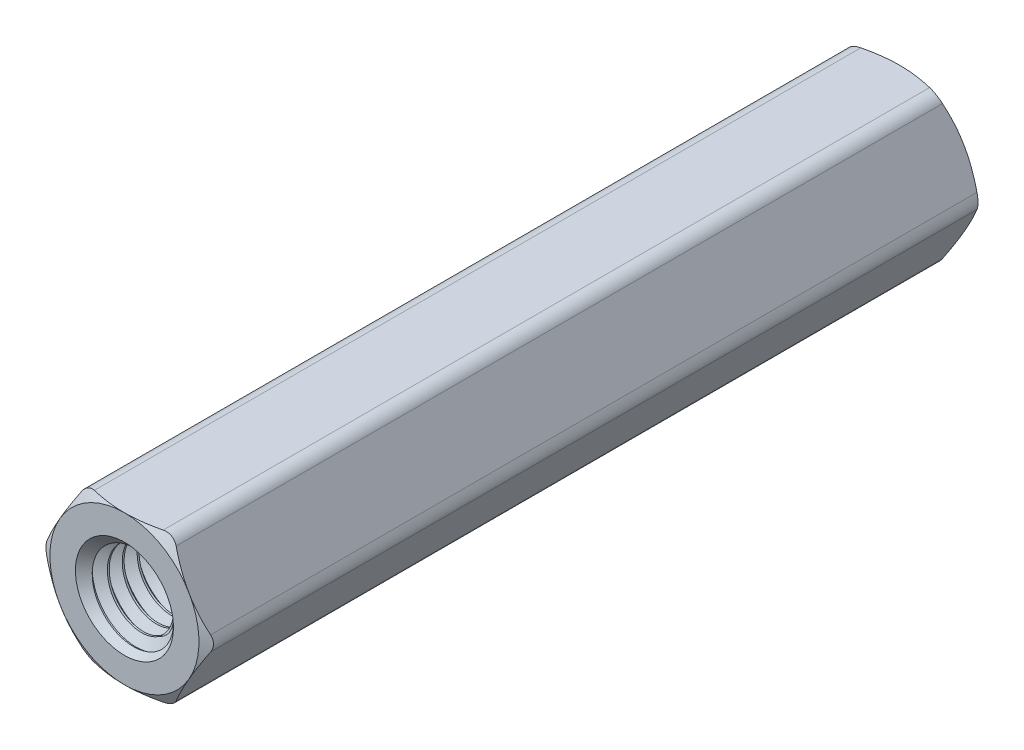
from build123d import *

# Parameters (mm, degrees)
SKETCH4_R           = 3.190875
BOSS_EXTRUDE1_DEPTH = 20.6375
SKETCH5_OUTSIDE_W   = 167.748
SKETCH5_OUTSIDE_H   = 166.52
SKETCH5_OUTSIDE_R   = 3.96875
CUT_EXTRUDE1_DEPTH  = 42.717836757
CUT_EXTRUDE1_DRAFT  = -60
SKETCH6_OUTSIDE_W   = 167.748
SKETCH6_OUTSIDE_H   = 166.52
SKETCH6_OUTSIDE_R   = 3.96875
CUT_EXTRUDE2_DEPTH  = 42.717836757
CUT_EXTRUDE2_DRAFT  = -60
FILLET1_R           = 0.79375
BOSS_EXTRUDE2_START = -12.7
SKETCH7_R           = 2.6114375
BOSS_EXTRUDE2_DEPTH = 12.7
SKETCH8_W           = 12.7
SKETCH8_H           = 2.413
CUT_SWEEP1_PITCH    = 0.79375
CUT_SWEEP1_TO       = 12.7
CIRPATTERN1_COUNT   = 2


with BuildPart() as part:
    # Sketch3 → Revolve1 (revolve)
    with BuildSketch(Plane(origin=(0, 0, 0), x_dir=(0, 0, -1), z_dir=(1, 0, 0))):
        Polygon((-20.4390625, 2.413), (-7.9375, 2.413), (-7.9375, 0), (7.9375, 0), (7.9375, 2.413), (20.6375, 2.413), (20.6375, 3.96875), (0, 3.96875), (-20.6375, 3.96875), (-20.6375, 2.6114375), align=None)
        Polygon((-20.4390625, 2.413), (-7.9375, 2.413), (-7.9375, 0), (7.9375, 0), (7.9375, 2.413), (20.6375, 2.413), (20.6375, 3.96875), (0, 3.96875), (-20.6375, 3.96875), (-20.6375, 2.6114375), align=None)
    revolve(axis=Axis((0, 0, 7.9375), (0, 0, 1)))

    # Sketch4 → Boss-Extrude1 (add, symmetric)
    with BuildSketch(Plane.XY):
        Polygon((-2.291358881, 3.96875), (-4.582717762, 0), (-2.291358881, -3.96875), (2.291358881, -3.96875), (4.582717762, 0), (2.291358881, 3.96875), align=None)
        Circle(SKETCH4_R, mode=Mode.SUBTRACT)
    extrude(amount=BOSS_EXTRUDE1_DEPTH, both=True)


with BuildPart() as cut_extrude1_tool:
    # Sketch5 outside → Cut-Extrude1 (with draft: the straight prism first)
    with BuildSketch(Plane.XY.offset(20.6375)):
        Rectangle(SKETCH5_OUTSIDE_W, SKETCH5_OUTSIDE_H)
        Circle(SKETCH5_OUTSIDE_R, mode=Mode.SUBTRACT)
    extrude(amount=-CUT_EXTRUDE1_DEPTH)
    # Cut-Extrude1: the draft: its side faces are tilted about the plane it starts from
    cut_extrude1_sides = [cut_extrude1_tool.faces().sort_by_distance(p)[0] for p in [
        (0, -83.26, -0.721418378),
        (83.874, 0, -0.721418378),
        (0, 83.26, -0.721418378),
        (-83.874, 0, -0.721418378),
        (-3.96875, 0, -0.721418378),
    ]]
    draft(cut_extrude1_sides, Plane.XY.offset(20.6375), CUT_EXTRUDE1_DRAFT)


with BuildPart() as part_1:
    add(part.part)

    # Cut-Extrude1: cut by cut_extrude1_tool
    add(cut_extrude1_tool.part, mode=Mode.SUBTRACT)


with BuildPart() as cut_extrude2_tool:
    # Sketch6 outside → Cut-Extrude2 (with draft: the straight prism first)
    with BuildSketch(Plane(origin=(0, 0, -20.6375), x_dir=(-1, 0, 0), z_dir=(0, 0, -1))):
        Rectangle(SKETCH6_OUTSIDE_W, SKETCH6_OUTSIDE_H)
        Circle(SKETCH6_OUTSIDE_R, mode=Mode.SUBTRACT)
    extrude(amount=-CUT_EXTRUDE2_DEPTH)
    # Cut-Extrude2: the draft: its side faces are tilted about the plane it starts from
    cut_extrude2_sides = [cut_extrude2_tool.faces().sort_by_distance(p)[0] for p in [
        (0, -83.26, 0.721418378),
        (-83.874, 0, 0.721418378),
        (0, 83.26, 0.721418378),
        (83.874, 0, 0.721418378),
        (3.96875, 0, 0.721418378),
    ]]
    draft(cut_extrude2_sides, Plane(origin=(0, 0, -20.6375), x_dir=(-1, 0, 0), z_dir=(0, 0, -1)), CUT_EXTRUDE2_DRAFT)


with BuildPart() as part_2:
    add(part_1.part)

    # Cut-Extrude2: cut by cut_extrude2_tool
    add(cut_extrude2_tool.part, mode=Mode.SUBTRACT)

    # Fillet1
    fillet1_edges = [part_2.edges().sort_by_distance(p)[0] for p in [
        (2.291358881, 3.96875, 0),
        (-4.582717762, 0, 0),
        (-2.291358881, -3.96875, 0),
        (2.291358881, -3.96875, 0),
        (4.582717762, 0, 0),
        (-2.291358881, 3.96875, 0),
    ]]
    fillet(fillet1_edges, radius=FILLET1_R)

    # Split1
    split(bisect_by=Plane.XY, keep=Keep.TOP)

    # Sketch7 → Boss-Extrude2 (add)
    with BuildSketch(Plane(origin=(0, 0, 7.9375), x_dir=(-1, 0, 0), z_dir=(0, 0, -1)).offset(BOSS_EXTRUDE2_START)):
        Circle(SKETCH7_R)
    extrude(amount=BOSS_EXTRUDE2_DEPTH)


with BuildPart() as body_2:
    # Sketch8 → Revolve2 (revolve)
    with BuildSketch(Plane(origin=(0, 0, 0), x_dir=(0, 0, -1), z_dir=(1, 0, 0))):
        with Locations((-14.2875, 1.2065)):
            Rectangle(SKETCH8_W, SKETCH8_H)
    revolve(axis=Axis((0, 0, 7.9375), (0, 0, 1)))

    # Cut-Sweep1: arcs per turn and ends read off the stored shape
    # Cut-Sweep1: the profile of Sketch10 screwed along a right-hand helix through 18 turns, 8 arcs to a turn; built about Z, then put on its axis
    cut_sweep1_z = Axis((0, 0, 0), (0, 0, 1))
    cut_sweep1_corners = [(1.897444252, 0, -1.190625), (1.897444252, 0, -1.09140625), (2.455962979, 0, -0.768945313), (2.455962979, 0, -1.513085938)]
    with BuildLine(mode=Mode.PRIVATE) as cut_sweep1_profile:
        Line(cut_sweep1_corners[0], cut_sweep1_corners[1])
        Line(cut_sweep1_corners[1], cut_sweep1_corners[2])
        Line(cut_sweep1_corners[2], cut_sweep1_corners[3])
        Line(cut_sweep1_corners[3], cut_sweep1_corners[0])
    cut_sweep1_cap = Face(cut_sweep1_profile.wire())
    cut_sweep1_turn_angles = [0, 22.5, 45, 67.5, 90, 112.5, 135, 157.5, 180, 202.5, 225, 247.5, 270, 292.5, 315, 337.5, 360]
    cut_sweep1_turn_weights = [1, 0.9238795325112867, 1, 0.9238795325112867, 1, 0.9238795325112867, 1, 0.9238795325112867, 1, 0.9238795325112867, 1, 0.9238795325112867, 1, 0.9238795325112867, 1, 0.9238795325112867, 1]
    cut_sweep1_turn_rails = [Edge.make_bspline([Vector(p[0], p[1], 0).rotate(cut_sweep1_z, cut_sweep1_turn_angles[k]) / cut_sweep1_turn_weights[k] + Vector(0, 0, p[2] + CUT_SWEEP1_PITCH * cut_sweep1_turn_angles[k] / 360) for k in range(17)], [0, 0, 0, 1, 1, 2, 2, 3, 3, 4, 4, 5, 5, 6, 6, 7, 7, 8, 8, 8], 2, cut_sweep1_turn_weights) for p in cut_sweep1_corners]
    cut_sweep1_turn_sides = [Face.make_surface_from_curves(cut_sweep1_turn_rails[p[0]], cut_sweep1_turn_rails[p[1]]) for p in [(0, 1), (1, 2), (2, 3), (3, 0)]]
    cut_sweep1 = Plane(origin=(0, 0, 20.6375), x_dir=(0, 1, 0), z_dir=(0, 0, -1)) * split(Solid(Shell([*[p.moved(Location((0, 0, CUT_SWEEP1_PITCH * i))) for i in range(18) for p in cut_sweep1_turn_sides], cut_sweep1_cap, cut_sweep1_cap.rotate(cut_sweep1_z, 6480).moved(Location((0, 0, CUT_SWEEP1_PITCH * 6480 / 360)))])), bisect_by=Plane.XY.offset(CUT_SWEEP1_TO), keep=Keep.BOTTOM, mode=Mode.PRIVATE)
    add(cut_sweep1, mode=Mode.SUBTRACT)


with BuildPart() as part_3:
    add(part_2.part)

    # Combine1: cut body 2
    add(body_2.part, mode=Mode.SUBTRACT)

    # Cut-Extrude3 cone 1 section (through the dimple's axis) → Cut-Extrude3 (revolve, cut)
    with BuildSketch(Plane(origin=(0, 0, 20.6375), x_dir=(0, -1, 0), z_dir=(1, 0, 0))):
        Polygon((0, 0), (2.6114375, 0), (0, 2.6114375), align=None)
    revolve(axis=Axis((0, 0, 20.6375), (0, 0, -1)), mode=Mode.SUBTRACT)


with BuildPart() as cirpattern1_1:
    # CirPattern1: pattern copy
    add(part_3.part.rotate(Axis((0, 0, 0), (1, 0, 0)), 1 * 360 / CIRPATTERN1_COUNT))


with BuildPart() as part_4:
    add(part_3.part)

    # Combine2: union CirPattern1_1
    add(cirpattern1_1.part)


solid = part_4.part
